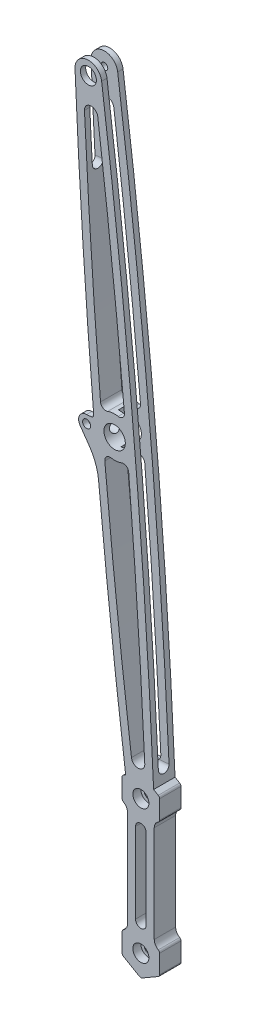
from build123d import *

# Parameters (mm, degrees)
SKETCH_1_R           = 3
EXTRUDE_1_DEPTH      = 4
EXTRUDE_1_2_DEPTH    = 4
SKETCH_2_W           = 10
SKETCH_2_H           = 39.607695154
EXTRUDE_2_DEPTH      = 8
FILLET_1_R           = 3
FILLET_2_R           = 1
CUT_EXTRUDE_1_DEPTH  = 8
SKETCH_8_R           = 3
EXTRUDE_4_DEPTH      = 5
HOLE_WIZARD_M3_1_D   = 3.4
EXTRUDE_5_DEPTH      = 8
HOLE_WIZARD_M3_1_2_D = 2.5
SKETCH_10_R          = 3
CUT_EXTRUDE_2_DEPTH  = 6
CUT_EXTRUDE_3_DEPTH  = 256.457880766
SKETCH_14_R          = 7.5
EXTRUDE_6_DEPTH      = 8
FILLET_3_R           = 2
SKETCH_15_R          = 4
CUT_EXTRUDE_4_DEPTH  = 256.457880878
CUT_EXTRUDE_6_DEPTH  = 256.393399125
CUT_EXTRUDE_9_DEPTH  = 256.393399125
SKETCH_23_R          = 2
CUT_EXTRUDE_10_DEPTH = 256.393399125
SKETCH_24_R          = 3
SKETCH_24_R_2        = 1.5
EXTRUDE_7_DEPTH      = 2
FILLET_4_R           = 20
FILLET_5_R           = 1


with BuildPart() as part:
    # ｽｹｯﾁ1 → ﾎﾞｽ - 押し出し1 (new, symmetric)
    with BuildSketch(Plane.XY):
        Polygon((0, -16.917096231), (7, -20.958548116), (7, -29.041451884), (0, -33.082903769), (-7, -29.041451884), (-7, -20.958548116), align=None)
        with Locations(Location((0, -25, 0), (0, 0, 180))):
            Circle(SKETCH_1_R, mode=Mode.SUBTRACT)
    extrude(amount=EXTRUDE_1_DEPTH, both=True)



with BuildPart() as body_2:
    # ｽｹｯﾁ1 → Extrude 1 2 (new, symmetric)
    with BuildSketch(Plane.XY):
        Polygon((7, 20.958548116), (7, 29.041451884), (0, 33.082903769), (-7, 29.041451884), (-7, 20.958548116), (0, 16.917096231), align=None)
        with Locations((0, 25)):
            Circle(SKETCH_1_R, mode=Mode.SUBTRACT)
    extrude(amount=EXTRUDE_1_2_DEPTH, both=True)


with BuildPart() as part_1:
    add(part.part)

    add(body_2.part)  # ﾎﾞｽ - 押し出し2 merges body 2
    # ｽｹｯﾁ2 → ﾎﾞｽ - 押し出し2 (add)
    with BuildSketch(Plane.XY.offset(4)):
        Rectangle(SKETCH_2_W, SKETCH_2_H)
    extrude(amount=-EXTRUDE_2_DEPTH)

    # ﾌｨﾚｯﾄ1
    fillet_1_edges = [part_1.edges().sort_by_distance(p)[0] for p in [
        (-5, -19.803847577, 0),
        (-5, 19.803847577, 0),
        (5, 19.803847577, 0),
        (5, -19.803847577, 0),
    ]]
    fillet(fillet_1_edges, radius=FILLET_1_R)

    # ﾌｨﾚｯﾄ2
    fillet_2_edges = [part_1.edges().sort_by_distance(p)[0] for p in [
        (-7, 20.958548116, 0),
        (-7, 29.041451884, 0),
        (0, 33.082903769, 0),
        (7, 29.041451884, 0),
        (7, 20.958548116, 0),
        (7, -29.041451884, 0),
        (0, -33.082903769, 0),
        (-7, -29.041451884, 0),
        (-7, -20.958548116, 0),
        (7, -20.958548116, 0),
    ]]
    fillet(fillet_2_edges, radius=FILLET_2_R - 0.0001)  # a hair under: the kernel refuses the full size

    # ｽｹｯﾁ3 → ｶｯﾄ - 押し出し1 (cut)
    with BuildSketch(Plane(origin=(0, 0, -4), x_dir=(-1, 0, 0), z_dir=(0, 0, -1))):
        with BuildLine():
            Line((-2, -15), (-2, 15))
            ThreePointArc((-2, 15), (0, 17), (2, 15))
            Line((2, 15), (2, -15))
            ThreePointArc((2, -15), (0, -17), (-2, -15))
        make_face()
    extrude(amount=-CUT_EXTRUDE_1_DEPTH, mode=Mode.SUBTRACT)

    # ｽｹｯﾁ8 → ﾎﾞｽ - 押し出し4 (add)
    with BuildSketch(Plane(origin=(0, 0, -4), x_dir=(-1, 0, 0), z_dir=(0, 0, -1))):
        with Locations((0, -25)):
            Circle(SKETCH_8_R)
        with Locations((0, 25)):
            Circle(SKETCH_8_R)
    extrude(amount=-EXTRUDE_4_DEPTH)

    # Hole Wizard M3 _1 (through all)
    with Locations(Plane(origin=(0, 0, 4), x_dir=(-1, 0, 0), z_dir=(0, 0, 1))):
        with Locations((0, -25), (0, 25)):
            Hole(HOLE_WIZARD_M3_1_D / 2)

    # ｽｹｯﾁ9 → ﾎﾞｽ - 押し出し5 (add)
    with BuildSketch(Plane.XY.offset(4)):
        with BuildLine():
            ThreePointArc((-24.60545694, 248.929725875), (-17.515120176, 139.163052252), (-5.674401923, 29.806786291))
            Line((-5.674401923, 29.806786291), (-0.5, 32.794228634))
            ThreePointArc((-0.5, 32.794228634), (0, 32.92820323), (0.5, 32.794228634))
            Line((0.5, 32.794228634), (4.77107276, 30.328323626))
            ThreePointArc((4.77107276, 30.328323626), (-2.557928959, 140.275299406), (-14.653344063, 249.80042293))
            ThreePointArc((-14.653344063, 249.80042293), (-20.045820832, 254.124780561), (-24.60545694, 248.929725875))
        make_face()
    extrude(amount=-EXTRUDE_5_DEPTH)

    # Hole Wizard M3 _1 2 (through all)
    with Locations(Plane.XY.offset(4)):
        with Locations((-19.610042118, 249.143807071)):
            Hole(HOLE_WIZARD_M3_1_2_D / 2)

    # ｽｹｯﾁ10 → ｶｯﾄ - 押し出し2 (cut)
    with BuildSketch(Plane.XY.offset(4)):
        with Locations((-19.610042118, 249.143807071)):
            Circle(SKETCH_10_R)
    extrude(amount=-CUT_EXTRUDE_2_DEPTH, mode=Mode.SUBTRACT)

    # ｽｹｯﾁ13 → ｶｯﾄ - 押し出し3 (cut, through all)
    with BuildSketch(Plane(origin=(0, 0, -4), x_dir=(-1, 0, 0), z_dir=(0, 0, -1))):
        with BuildLine():
            ThreePointArc((21.071643562, 237.188362315), (18.792354769, 239.797597896), (16.09460449, 237.623796811))
            ThreePointArc((16.09460449, 237.623796811), (5.322144918, 137.464104378), (-1.461601444, 36.955444756))
            ThreePointArc((-1.461601444, 36.955444756), (0.81768735, 34.346209174), (3.515437629, 36.520010259))
            ThreePointArc((3.515437629, 36.520010259), (14.287897201, 136.679702693), (21.071643562, 237.188362315))
        make_face()
    extrude(amount=-CUT_EXTRUDE_3_DEPTH, mode=Mode.SUBTRACT)

    # ｽｹｯﾁ14 → ﾎﾞｽ - 押し出し6 (add)
    with BuildSketch(Plane(origin=(0, 0, -4), x_dir=(-1, 0, 0), z_dir=(0, 0, -1))):
        with Locations((9.805021059, 137.071903535)):
            Circle(SKETCH_14_R)
    extrude(amount=-EXTRUDE_6_DEPTH)

    # ﾌｨﾚｯﾄ3
    fillet_3_edges = [part_1.edges().sort_by_distance(p)[0] for p in [
        (-13.757410706, 130.697845481, 0),
        (-14.804208592, 142.662800065, 0),
        (-4.805833526, 131.481007005, 0),
        (-5.852631412, 143.445961589, 0),
    ]]
    fillet(fillet_3_edges, radius=FILLET_3_R)

    # ｽｹｯﾁ15 → ｶｯﾄ - 押し出し4 (cut, through all)
    with BuildSketch(Plane.XY.offset(4)):
        with Locations((-9.805021059, 137.071903535)):
            Circle(SKETCH_15_R)
    extrude(amount=-CUT_EXTRUDE_4_DEPTH, mode=Mode.SUBTRACT)

    # ｽｹｯﾁ16 → ｶｯﾄ - 押し出し6 (cut, through all)
    with BuildSketch(Plane(origin=(2.170602221, 0.189903087, 0), x_dir=(0.08715574274765833, -0.9961946980917455, 0), z_dir=(0.9961946980917455, 0.08715574274765833, 0))):
        with BuildLine():
            Line((-254.904867452, 2), (-34.904867452, 2))
            ThreePointArc((-34.904867452, 2), (-32.904867452, 0), (-34.904867452, -2))
            Line((-34.904867452, -2), (-254.904867452, -2))
            ThreePointArc((-254.904867452, -2), (-256.904867452, 0), (-254.904867452, 2))
        make_face()
    extrude(amount=CUT_EXTRUDE_6_DEPTH, mode=Mode.SUBTRACT)

    # ｽｹｯﾁ22 → ｶｯﾄ - 押し出し9 (cut, through all)
    with BuildSketch(Plane(origin=(2.170602221, 0.189903087, 0), x_dir=(0, 0, -1), z_dir=(0.9961946980917457, 0.08715574274765832, 0))):
        with BuildLine():
            Line((2, 254.904867452), (2, 219.904867452))
            ThreePointArc((2, 219.904867452), (0, 217.904867452), (-2, 219.904867452))
            Line((-2, 219.904867452), (-2, 254.904867452))
            ThreePointArc((-2, 254.904867452), (0, 256.904867452), (2, 254.904867452))
        make_face()
    extrude(amount=-CUT_EXTRUDE_9_DEPTH, mode=Mode.SUBTRACT)

    # ｽｹｯﾁ23 → ｶｯﾄ - 押し出し10 (cut, through all)
    with BuildSketch(Plane(origin=(2.170602221, 0.189903087, 0), x_dir=(0, 0, -1), z_dir=(0.9961946980917457, 0.08715574274765835, 0))):
        with Locations(Location((0, 137.404867452, 0), (0, 0, 90))):
            Circle(SKETCH_23_R)
    extrude(amount=-CUT_EXTRUDE_10_DEPTH, mode=Mode.SUBTRACT)

    # ｽｹｯﾁ24 → ﾎﾞｽ - 押し出し7 (add)
    # profile 1 of 3: a face of its own
    with BuildSketch(Plane.XY.offset(4)):
        with Locations((-20.265065389, 136.156768236)):
            Circle(SKETCH_24_R)
        with Locations((-20.265065389, 136.156768236)):
            Circle(SKETCH_24_R_2, mode=Mode.SUBTRACT)
    # profile 2 of 3: a face of its own
    with BuildSketch(Plane.XY.offset(4)):
        with BuildLine():
            ThreePointArc((-17.265065389, 136.156768236), (-19.362947991, 133.295617384), (-22.722521522, 134.436038927))
            Line((-22.722521522, 134.436038927), (-16.272118562, 125.223908797))
            ThreePointArc((-16.272118562, 125.223908797), (-16.780497765, 130.820515846), (-17.276481258, 136.418235046))
            ThreePointArc((-17.276481258, 136.418235046), (-17.267920715, 136.287626188), (-17.265065389, 136.156768236))
        make_face()
    # profile 3 of 3: a face of its own
    with BuildSketch(Plane.XY.offset(4)):
        with BuildLine():
            Line((-17.53520033, 139.395600482), (-20.265065389, 139.156768236))
            ThreePointArc((-20.265065389, 139.156768236), (-18.238294611, 138.368600105), (-17.276481258, 136.418235046))
            ThreePointArc((-17.276481258, 136.418235046), (-17.406279124, 137.906879675), (-17.53520033, 139.395600482))
        make_face()
    extrude_7 = extrude(amount=-EXTRUDE_7_DEPTH)

    # ﾐﾗｰ1: ﾎﾞｽ - 押し出し7 across plane
    add(extrude_7.mirror(Plane.XY))

    # ﾌｨﾚｯﾄ4
    fillet_4_edges = [part_1.edges().sort_by_distance(p)[0] for p in [
        (-16.272118562, 125.223908797, 3),
        (-16.272118562, 125.223908797, -3),
    ]]
    fillet(fillet_4_edges, radius=FILLET_4_R)

    # ﾌｨﾚｯﾄ5
    fillet_5_edges = [part_1.edges().sort_by_distance(p)[0] for p in [
        (-17.53520033, 139.395600482, 3),
        (-17.53520033, 139.395600482, -3),
    ]]
    fillet(fillet_5_edges, radius=FILLET_5_R)


solid = part_1.part
